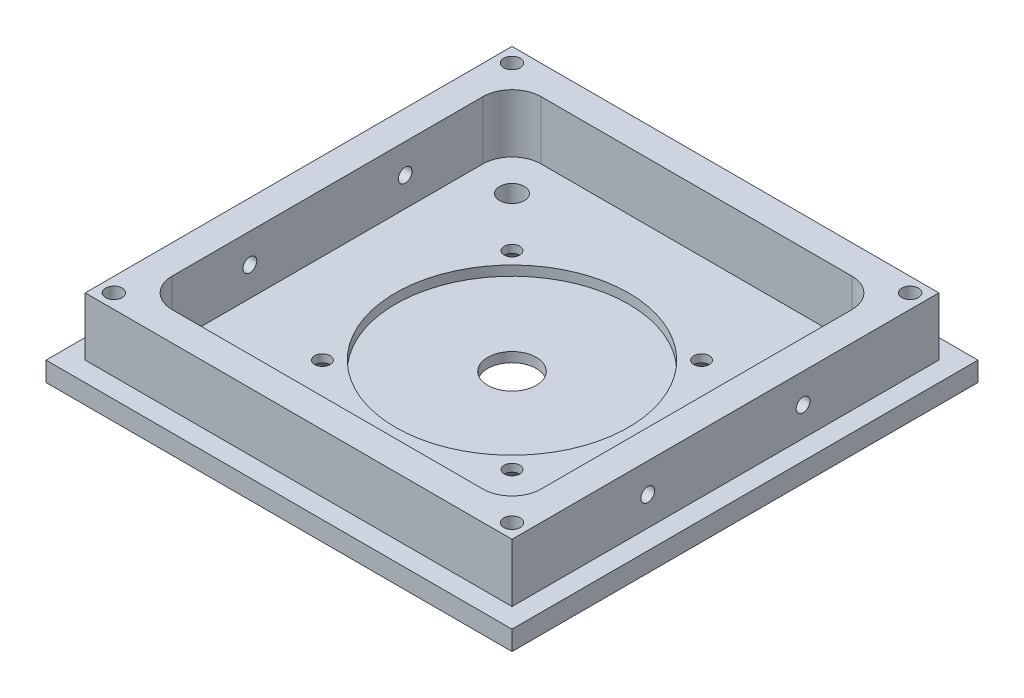
from build123d import *
from OCP.BRepFilletAPI import BRepFilletAPI_MakeChamfer

# Parameters (mm, degrees)
SKETCH1_W                    = 76.2
SKETCH1_H                    = 76.2
BOSS_EXTRUDE1_DEPTH          = 3.175
SKETCH2_W                    = 69.79412
SKETCH2_H                    = 69.79412
SKETCH2_W_2                  = 60.325
SKETCH2_H_2                  = 60.325
BOSS_EXTRUDE2_DEPTH          = 9.525
FILLET1_R                    = 4.7625
SKETCH3_R                    = 19.05
CUT_EXTRUDE1_DEPTH           = 1.5875
SKETCH4_R                    = 3.96875
CUT_EXTRUDE2_DEPTH           = 56.015521957
F_39_0_0995_DIAMETER_HOLE1_D = 2.5273
F_10_32_TAPPED_HOLE1_D       = 4.0386
CHAMFER1_SIZE                = 1.905
CHAMFER1_SIZE2               = 1.655991236
F_6_32_TAPPED_HOLE1_D        = 2.7051
CIRPATTERN1_COUNT            = 4


with BuildPart() as part:
    # Sketch1 → Boss-Extrude1 (new body)
    with BuildSketch(Plane(origin=(0, 0, 0), x_dir=(1, 0, 0), z_dir=(0, 1, 0))):
        Rectangle(SKETCH1_W, SKETCH1_H)
    extrude(amount=BOSS_EXTRUDE1_DEPTH)

    # Sketch2 → Boss-Extrude2 (add)
    with BuildSketch(Plane(origin=(0, 3.175, 0), x_dir=(1, 0, 0), z_dir=(0, 1, 0))):
        Rectangle(SKETCH2_W, SKETCH2_H)
        Rectangle(SKETCH2_W_2, SKETCH2_H_2, mode=Mode.SUBTRACT)
    extrude(amount=BOSS_EXTRUDE2_DEPTH)

    # Fillet1
    fillet1_edges = [part.edges().sort_by_distance(p)[0] for p in [
        (-30.1625, 7.9375, 30.1625),
        (30.1625, 7.9375, 30.1625),
        (30.1625, 7.9375, -30.1625),
        (-30.1625, 7.9375, -30.1625),
    ]]
    fillet(fillet1_edges, radius=FILLET1_R)

    # Sketch3 → Cut-Extrude1 (cut)
    with BuildSketch(Plane(origin=(0, 3.175, 0), x_dir=(1, 0, 0), z_dir=(0, 1, 0))):
        Circle(SKETCH3_R)
    extrude(amount=-CUT_EXTRUDE1_DEPTH, mode=Mode.SUBTRACT)

    # Sketch4 → Cut-Extrude2 (cut, through all)
    with BuildSketch(Plane(origin=(0, 1.5875, 0), x_dir=(1, 0, 0), z_dir=(0, 1, 0))):
        Circle(SKETCH4_R)
    extrude(amount=-CUT_EXTRUDE2_DEPTH, mode=Mode.SUBTRACT)

    # #39 (0.0995) Diameter Hole1 (through all)
    with Locations(Plane(origin=(0, 3.175, 0), x_dir=(1, 0, 0), z_dir=(0, 1, 0))):
        with Locations((15.5, 15.5), (-15.5, 15.5), (-15.5, -15.5), (15.5, -15.5), (-23.5966, 23.5966), (23.5966, 23.5966), (23.5966, -23.5966), (-23.5966, -23.5966)):
            Hole(F_39_0_0995_DIAMETER_HOLE1_D / 2)

    # #10-32 Tapped Hole1 (through all)
    with Locations(Plane(origin=(0, 3.175, 0), x_dir=(1, 0, 0), z_dir=(0, 1, 0))):
        with Locations((-23.5966, 23.5966), (23.5966, 23.5966), (23.5966, -23.5966), (-23.5966, -23.5966)):
            Hole(F_10_32_TAPPED_HOLE1_D / 2)

    # Sketch9 → #4-40 Tapped Hole1 (revolve, cut)
    with BuildSketch(Plane(origin=(34.89706, 7.9375, 12.7), x_dir=(0, 0, -1), z_dir=(0, 1, 0))):
        Polygon((0, 0), (0, 7.283152758), (1.1303, 6.604), (1.1303, 0), align=None)
    f_4_40_tapped_hole1 = revolve(axis=Axis((41.24706, 7.9375, 12.7), (-1, 0, 0)), mode=Mode.SUBTRACT)

    # Mirror1: #4-40 Tapped Hole1 across plane
    add(f_4_40_tapped_hole1.mirror(Plane.XY), mode=Mode.SUBTRACT)

    # Mirror2 copy 1 sketch → Mirror2 copy 1 (revolve, cut)
    with BuildSketch(Plane(origin=(-34.89706, 7.9375, -12.7), x_dir=(0, 0, 1), z_dir=(0, 1, 0))):
        Polygon((0, 0), (0, 7.283152758), (1.1303, 6.604), (1.1303, 0), align=None)
    revolve(axis=Axis((-41.24706, 7.9375, -12.7), (1, 0, 0)), mode=Mode.SUBTRACT)

    # Mirror2 copy 2 sketch → Mirror2 copy 2 (revolve, cut)
    with BuildSketch(Plane(origin=(-34.89706, 7.9375, 12.7), x_dir=(0, 0, -1), z_dir=(0, 1, 0))):
        Polygon((0, 0), (0, -7.283152758), (1.1303, -6.604), (1.1303, 0), align=None)
    revolve(axis=Axis((-41.24706, 7.9375, 12.7), (-1, 0, 0)), mode=Mode.SUBTRACT)

    # Chamfer1: one chamfer whose edges measure the first distance from different faces: ONE call of the kernel's chamfer builder (chamfer() names one face for all edges)
    chamfer1_edges_1 = [part.edges().sort_by_distance(p)[0] for p in [
        (-14.23635, 0, -15.5),
    ]]
    chamfer1_side_1 = [part.faces().sort_by_distance(p)[0] for p in [
        (-14.23635, 1.5875, -15.5),
    ]]
    chamfer1_edges_2 = [part.edges().sort_by_distance(p)[0] for p in [
        (16.76365, 0, -15.5),
    ]]
    chamfer1_side_2 = [part.faces().sort_by_distance(p)[0] for p in [
        (16.76365, 1.5875, -15.5),
    ]]
    chamfer1_edges_3 = [part.edges().sort_by_distance(p)[0] for p in [
        (16.76365, 0, 15.5),
    ]]
    chamfer1_side_3 = [part.faces().sort_by_distance(p)[0] for p in [
        (16.76365, 1.5875, 15.5),
    ]]
    chamfer1_edges_4 = [part.edges().sort_by_distance(p)[0] for p in [
        (-14.23635, 0, 15.5),
    ]]
    chamfer1_side_4 = [part.faces().sort_by_distance(p)[0] for p in [
        (-14.23635, 1.5875, 15.5),
    ]]
    chamfer1 = BRepFilletAPI_MakeChamfer(part.part.solid().wrapped)
    for e in chamfer1_edges_1:
        chamfer1.Add(CHAMFER1_SIZE, CHAMFER1_SIZE2, e.wrapped, chamfer1_side_1[0].wrapped)  # the first distance lies on this face
    for e in chamfer1_edges_2:
        chamfer1.Add(CHAMFER1_SIZE, CHAMFER1_SIZE2, e.wrapped, chamfer1_side_2[0].wrapped)  # the first distance lies on this face
    for e in chamfer1_edges_3:
        chamfer1.Add(CHAMFER1_SIZE, CHAMFER1_SIZE2, e.wrapped, chamfer1_side_3[0].wrapped)  # the first distance lies on this face
    for e in chamfer1_edges_4:
        chamfer1.Add(CHAMFER1_SIZE, CHAMFER1_SIZE2, e.wrapped, chamfer1_side_4[0].wrapped)  # the first distance lies on this face
    add(Compound.cast(chamfer1.Shape()), mode=Mode.REPLACE)

    # #6-32 Tapped Hole1 (through all)
    with Locations(Plane(origin=(0, 0, 0), x_dir=(-1, 0, 0), z_dir=(0, -1, 0))):
        with Locations((-32.5501, 32.5501)):
            f_6_32_tapped_hole1 = Hole(F_6_32_TAPPED_HOLE1_D / 2)

    # CirPattern1: #6-32 Tapped Hole1 ×4 about axis
    cirpattern1_axis = Axis((0, 0, 0), (0, 1, 0))
    for i in range(1, CIRPATTERN1_COUNT):
        add(f_6_32_tapped_hole1.rotate(cirpattern1_axis, i * 360 / CIRPATTERN1_COUNT), mode=Mode.SUBTRACT)


solid = part.part
